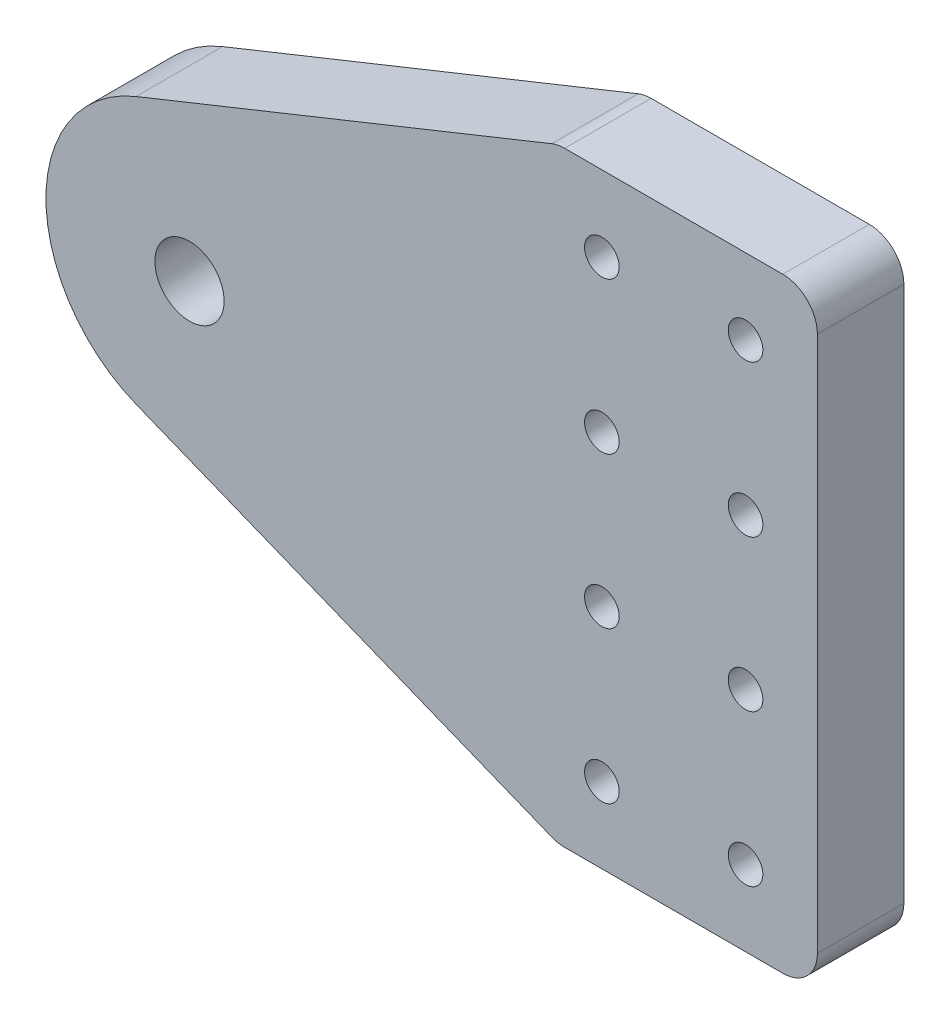
from build123d import *

# Parameters (mm, degrees)
SKETCH1_R           = 2.54
SKETCH1_R_2         = 5.08
BOSS_EXTRUDE1_DEPTH = 12.7


with BuildPart() as part:
    # Sketch1 → Boss-Extrude1 (new body)
    with BuildSketch(Plane.XY):
        with BuildLine():
            Line((877.282099838, -292.1), (909.32, -292.1))
            ThreePointArc((909.32, -292.1), (912.912102448, -290.612102448), (914.4, -287.02))
            Line((914.4, -287.02), (914.4, -208.28))
            ThreePointArc((914.4, -208.28), (912.912102448, -204.687897552), (909.32, -203.2))
            Line((909.32, -203.2), (877.282099838, -203.2))
            ThreePointArc((877.282099838, -203.2), (876.317854156, -203.292352231), (875.388667624, -203.566051077))
            Line((875.388667624, -203.566051077), (814.340256312, -228.087111968))
            ThreePointArc((814.340256312, -228.087111968), (801.116, -247.65), (814.340256312, -267.212888032))
            Line((814.340256312, -267.212888032), (875.388667624, -291.733948923))
            ThreePointArc((875.388667624, -291.733948923), (876.317854156, -292.007647769), (877.282099838, -292.1))
        make_face()
        with Locations((903.850524959, -214.298026916)):
            Circle(SKETCH1_R, mode=Mode.SUBTRACT)
        with Locations((882.751574878, -214.298026916)):
            Circle(SKETCH1_R, mode=Mode.SUBTRACT)
        with Locations((882.751574878, -236.551973084)):
            Circle(SKETCH1_R, mode=Mode.SUBTRACT)
        with Locations((903.850524959, -236.551973084)):
            Circle(SKETCH1_R, mode=Mode.SUBTRACT)
        with Locations((882.751574878, -258.748026916)):
            Circle(SKETCH1_R, mode=Mode.SUBTRACT)
        with Locations((882.751574878, -281.001973084)):
            Circle(SKETCH1_R, mode=Mode.SUBTRACT)
        with Locations((903.850524959, -258.748026916)):
            Circle(SKETCH1_R, mode=Mode.SUBTRACT)
        with Locations((903.850524959, -281.001973084)):
            Circle(SKETCH1_R, mode=Mode.SUBTRACT)
        with Locations((822.198, -247.65)):
            Circle(SKETCH1_R_2, mode=Mode.SUBTRACT)
    extrude(amount=BOSS_EXTRUDE1_DEPTH)


solid = part.part
